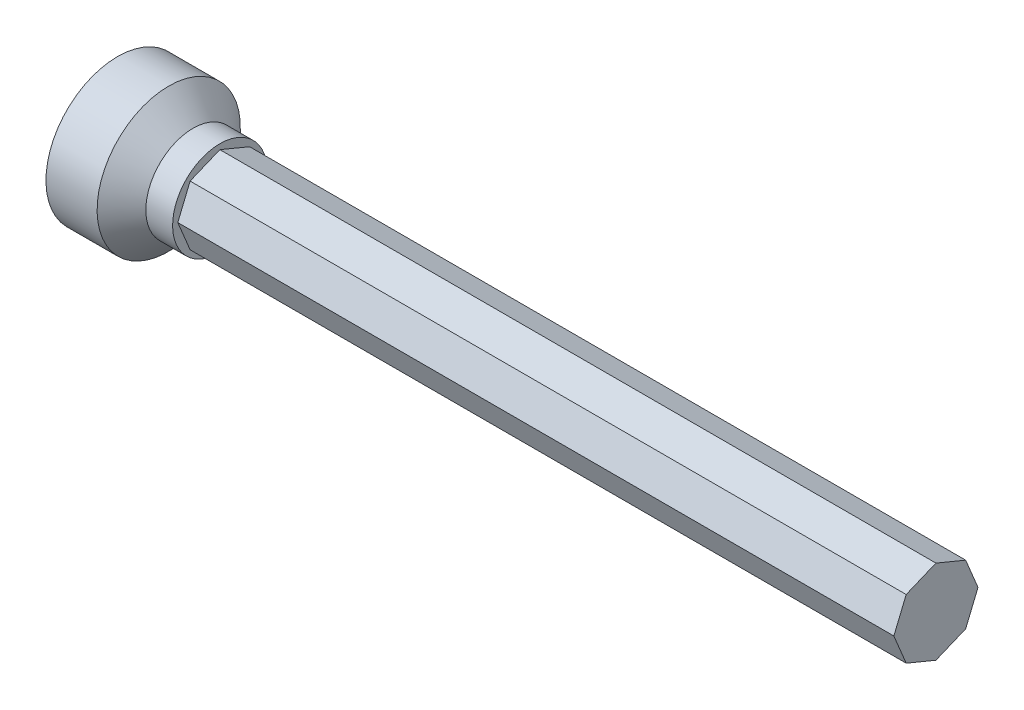
from build123d import *

# Parameters (mm, degrees)
BOSS_EXTRUDE1_DEPTH = 35


with BuildPart() as part:
    # Sketch1 → Boss-Extrude1 (new body)
    with BuildSketch(Plane(origin=(0, 0, 0), x_dir=(0, 0, -1), z_dir=(1, 0, 0))):
        Polygon((-2.056545181, 0), (-1.454197043, -1.454197043), (0, -2.056545181), (1.454197043, -1.454197043), (2.056545181, 0), (1.454197043, 1.454197043), (0, 2.056545181), (-1.454197043, 1.454197043), align=None)
    extrude(amount=BOSS_EXTRUDE1_DEPTH)

    # Sketch4 → Revolve1 (revolve)
    with BuildSketch(Plane.XY):
        Polygon((0, 0), (-5, 0), (-5, 3.5), (-2.5, 3.5), (-1.309401077, 2.309401077), (0, 2.309401077), align=None)
    revolve(axis=Axis((0, 0, 0), (-1, 0, 0)))


solid = part.part
